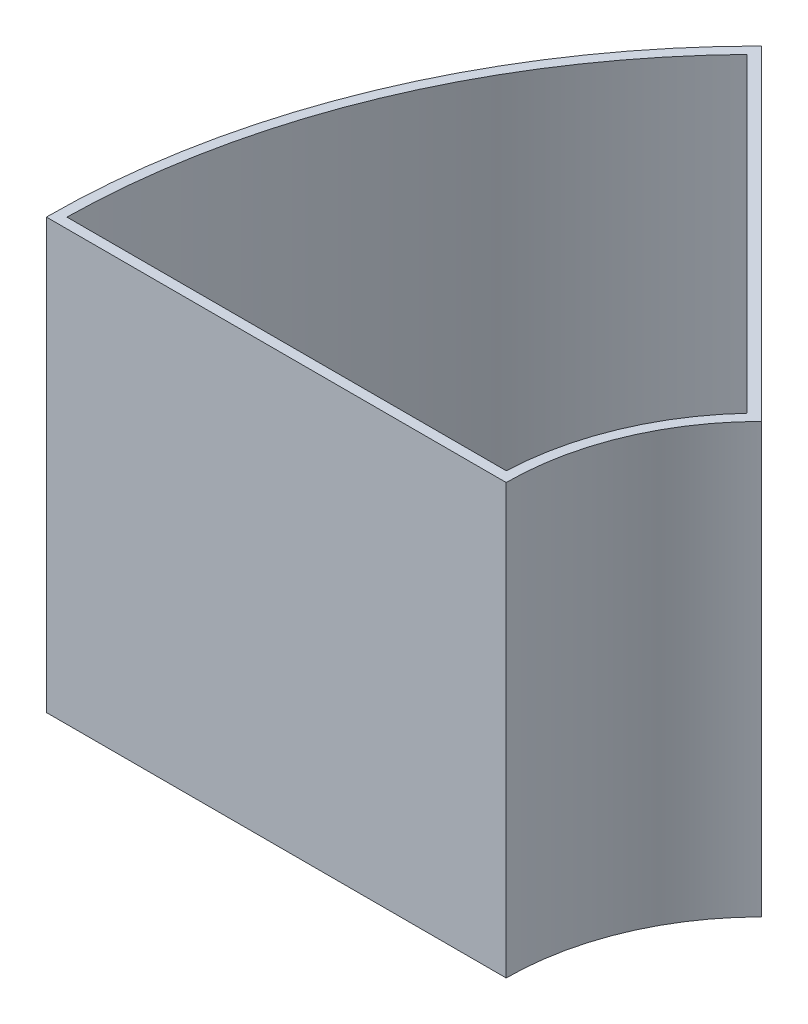
from build123d import *

# Parameters (mm, degrees)
SALIENTE_EXTRUIR1_DEPTH = 40
VACIADO1_T              = -1
SALIENTE_EXTRUIR3_START = 2
SALIENTE_EXTRUIR3_DEPTH = 2
CORTAR_EXTRUIR1_DEPTH   = 2
CROQUIS5_R              = 2.5
CORTAR_EXTRUIR2_DEPTH   = 2


with BuildPart() as part:
    # Croquis1 → Saliente-Extruir1 (new body)
    with BuildSketch(Plane(origin=(0, 0, 0), x_dir=(1, 0, 0), z_dir=(0, 1, 0))):
        with BuildLine():
            Line((-25, 0), (-70, 0))
            ThreePointArc((-70, 0), (-64.671567276, 26.787840266), (-49.497474683, 49.497474683))
            Line((-49.497474683, 49.497474683), (-17.67766953, 17.67766953))
            ThreePointArc((-17.67766953, 17.67766953), (-23.096988313, 9.567085809), (-25, 0))
        make_face()
    extrude(amount=SALIENTE_EXTRUIR1_DEPTH)

    # Vaciado1
    vaciado1_openings = [part.faces().sort_by_distance(p)[0] for p in [
        (-45.963517193, 40, -19.038712196),
    ]]
    offset(amount=VACIADO1_T, openings=vaciado1_openings, kind=Kind.INTERSECTION)

    # Croquis4 → Saliente-Extruir3 (add)
    with BuildSketch(Plane.XZ.offset(SALIENTE_EXTRUIR3_START)):
        with BuildLine():
            Line((-25, 0), (-70, 0))
            ThreePointArc((-70, 0), (-64.671567276, -26.787840266), (-49.497474683, -49.497474683))
            Line((-49.497474683, -49.497474683), (-17.67766953, -17.67766953))
            ThreePointArc((-17.67766953, -17.67766953), (-23.096988313, -9.567085809), (-25, 0))
        make_face()
    extrude(amount=-SALIENTE_EXTRUIR3_DEPTH)

    # Croquis2 → Cortar-Extruir1 (cut)
    with BuildSketch(Plane(origin=(0, -2, 0), x_dir=(1, 0, 0), z_dir=(0, 1, 0))):
        with BuildLine():
            Line((-38.909722104, 27.244880727), (-30.718201661, 21.509116363))
            ThreePointArc((-30.718201661, 21.509116363), (-34.645482469, 14.350628714), (-36.930290738, 6.511806663))
            Line((-36.930290738, 6.511806663), (-46.778368268, 8.248288439))
            ThreePointArc((-46.778368268, 8.248288439), (-43.884277794, 18.177463037), (-38.909722104, 27.244880727))
        make_face()
    extrude(amount=CORTAR_EXTRUIR1_DEPTH, mode=Mode.SUBTRACT)

    # Croquis5 → Cortar-Extruir2 (cut)
    with BuildSketch(Plane(origin=(0, 1, 0), x_dir=(1, 0, 0), z_dir=(0, 1, 0))):
        with Locations((-55.432771951, 22.961005942)):
            Circle(CROQUIS5_R)
    extrude(amount=-CORTAR_EXTRUIR2_DEPTH, mode=Mode.SUBTRACT)


solid = part.part
